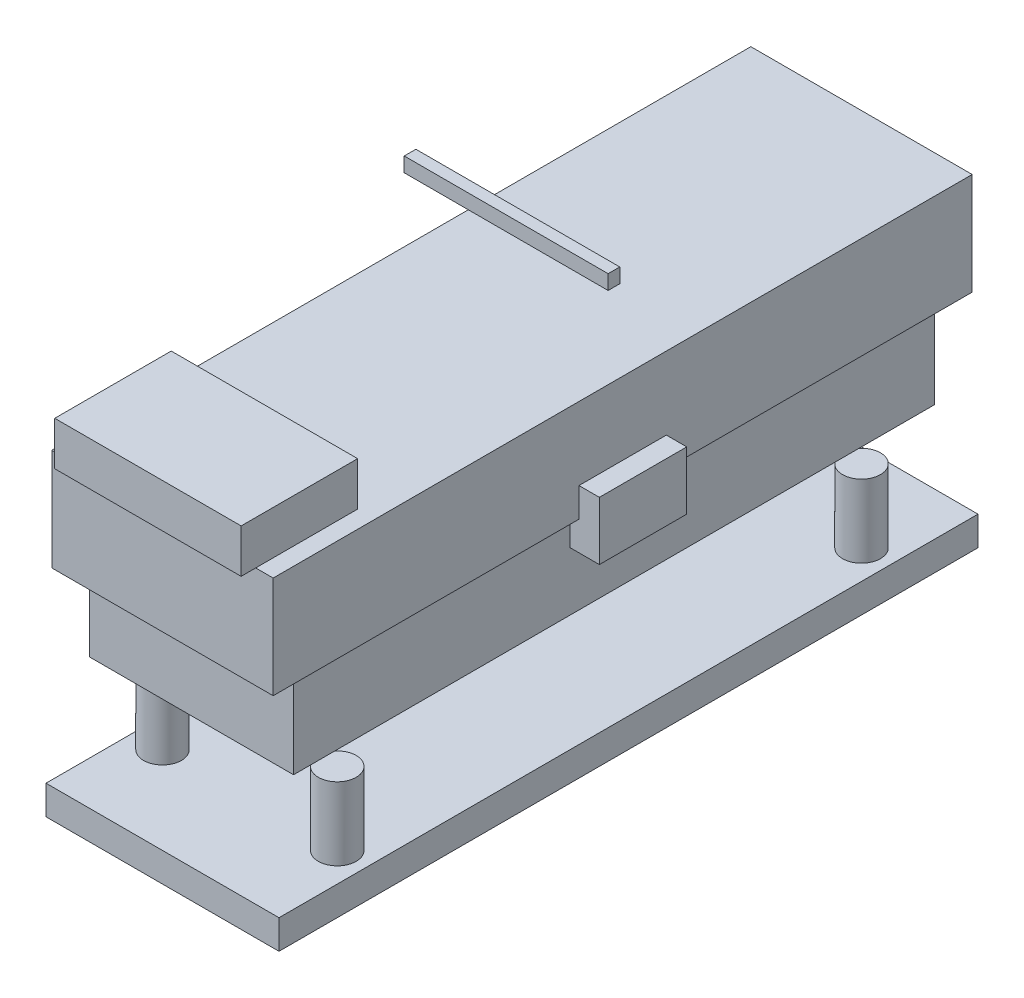
from build123d import *

# Parameters (mm, degrees)
SKETCH1_W            = 800
SKETCH1_H            = 2400
BOSS_EXTRUDE1_DEPTH  = 100
BOSS_EXTRUDE2_START  = 100
SKETCH2_R            = 65
BOSS_EXTRUDE2_DEPTH  = 250
BOSS_EXTRUDE3_START  = 100
SKETCH3_R            = 65
BOSS_EXTRUDE3_DEPTH  = 250
BOSS_EXTRUDE4_START  = 100
SKETCH4_R            = 65
BOSS_EXTRUDE4_DEPTH  = 250
BOSS_EXTRUDE5_START  = 100
SKETCH5_R            = 65
BOSS_EXTRUDE5_DEPTH  = 250
BOSS_EXTRUDE6_START  = 450
SKETCH6_W            = 700
SKETCH6_H            = 2200
BOSS_EXTRUDE6_DEPTH  = 400
BOSS_EXTRUDE7_START  = 450
SKETCH7_R            = 60
BOSS_EXTRUDE7_DEPTH  = 150
BOSS_EXTRUDE8_START  = 750
SKETCH8_W            = 760
SKETCH8_H            = 2400
BOSS_EXTRUDE8_DEPTH  = 350
BOSS_EXTRUDE9_START  = 1100
SKETCH9_W            = 640
SKETCH9_H            = 400
BOSS_EXTRUDE9_DEPTH  = 150
BOSS_EXTRUDE10_START = 1350
SKETCH10_W           = 700
SKETCH10_H           = 40
BOSS_EXTRUDE10_DEPTH = 50
BOSS_EXTRUDE11_START = 650
SKETCH11_W           = 900
SKETCH11_H           = 300
BOSS_EXTRUDE11_DEPTH = 200


with BuildPart() as part:
    # Sketch1 → Boss-Extrude1 (new body)
    with BuildSketch(Plane(origin=(0, 0, 0), x_dir=(1, 0, 0), z_dir=(0, 1, 0))):
        with Locations((0, 1200)):
            Rectangle(SKETCH1_W, SKETCH1_H)
    extrude(amount=BOSS_EXTRUDE1_DEPTH)

    # Sketch2 → Boss-Extrude2 (add)
    with BuildSketch(Plane(origin=(0, 0, 0), x_dir=(1, 0, 0), z_dir=(0, 1, 0)).offset(BOSS_EXTRUDE2_START)):
        with Locations((-300, 300)):
            Circle(SKETCH2_R)
    extrude(amount=BOSS_EXTRUDE2_DEPTH)

    # Sketch3 → Boss-Extrude3 (add)
    with BuildSketch(Plane(origin=(0, 0, 0), x_dir=(1, 0, 0), z_dir=(0, 1, 0)).offset(BOSS_EXTRUDE3_START)):
        with Locations((300, 300)):
            Circle(SKETCH3_R)
    extrude(amount=BOSS_EXTRUDE3_DEPTH)

    # Sketch4 → Boss-Extrude4 (add)
    with BuildSketch(Plane(origin=(0, 0, 0), x_dir=(1, 0, 0), z_dir=(0, 1, 0)).offset(BOSS_EXTRUDE4_START)):
        with Locations((-300, 2100)):
            Circle(SKETCH4_R)
    extrude(amount=BOSS_EXTRUDE4_DEPTH)

    # Sketch5 → Boss-Extrude5 (add)
    with BuildSketch(Plane(origin=(0, 0, 0), x_dir=(1, 0, 0), z_dir=(0, 1, 0)).offset(BOSS_EXTRUDE5_START)):
        with Locations((300, 2100)):
            Circle(SKETCH5_R)
    extrude(amount=BOSS_EXTRUDE5_DEPTH)


with BuildPart() as body_2:
    # Sketch6 → Boss-Extrude6 (new body)
    with BuildSketch(Plane(origin=(0, 0, 0), x_dir=(1, 0, 0), z_dir=(0, 1, 0)).offset(BOSS_EXTRUDE6_START)):
        with Locations((0, 1200)):
            Rectangle(SKETCH6_W, SKETCH6_H)
    extrude(amount=BOSS_EXTRUDE6_DEPTH)

    # Sketch7 → Boss-Extrude7 (add)
    with BuildSketch(Plane(origin=(0, 0, 0), x_dir=(1, 0, 0), z_dir=(0, 1, 0)).offset(BOSS_EXTRUDE7_START)):
        with Locations((0, 1200)):
            Circle(SKETCH7_R)
    extrude(amount=-BOSS_EXTRUDE7_DEPTH)

    # Sketch8 → Boss-Extrude8 (add)
    with BuildSketch(Plane(origin=(0, 0, 0), x_dir=(1, 0, 0), z_dir=(0, 1, 0)).offset(BOSS_EXTRUDE8_START)):
        with Locations((0, 1200)):
            Rectangle(SKETCH8_W, SKETCH8_H)
    extrude(amount=BOSS_EXTRUDE8_DEPTH)

    # Sketch9 → Boss-Extrude9 (add)
    with BuildSketch(Plane(origin=(0, 0, 0), x_dir=(1, 0, 0), z_dir=(0, 1, 0)).offset(BOSS_EXTRUDE9_START)):
        with Locations((0, 150)):
            Rectangle(SKETCH9_W, SKETCH9_H)
    extrude(amount=BOSS_EXTRUDE9_DEPTH)

    # Sketch11 → Boss-Extrude11 (add)
    with BuildSketch(Plane(origin=(0, 0, 0), x_dir=(1, 0, 0), z_dir=(0, 1, 0)).offset(BOSS_EXTRUDE11_START)):
        with Locations((0, 1200)):
            Rectangle(SKETCH11_W, SKETCH11_H)
    extrude(amount=BOSS_EXTRUDE11_DEPTH)


with BuildPart() as body_3:
    # Sketch10 → Boss-Extrude10 (new body)
    with BuildSketch(Plane(origin=(0, 0, 0), x_dir=(1, 0, 0), z_dir=(0, 1, 0)).offset(BOSS_EXTRUDE10_START)):
        with Locations((0, 1200)):
            Rectangle(SKETCH10_W, SKETCH10_H)
    extrude(amount=BOSS_EXTRUDE10_DEPTH)


solid = Compound([part.part, body_2.part, body_3.part])
